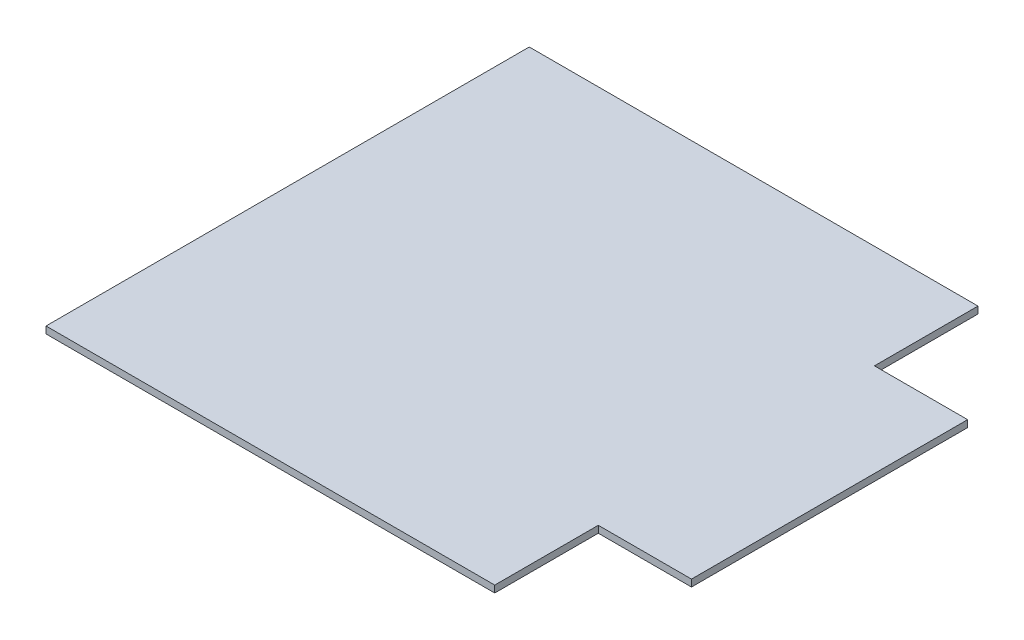
from build123d import *

# Parameters (mm, degrees)
BOSS_EXTRUDE1_DEPTH = 2


with BuildPart() as part:
    # Sketch1 → Boss-Extrude1 (new body)
    with BuildSketch(Plane(origin=(0, 0, 0), x_dir=(1, 0, 0), z_dir=(0, 1, 0))):
        Polygon((2.79533546, 60.475696308), (2.79533546, -79.524303692), (132.79533546, -79.524303692), (132.79533546, -49.524303692), (159.79533546, -49.524303692), (159.79533546, 30.475696308), (132.79533546, 30.475696308), (132.79533546, 60.475696308), align=None)
    extrude(amount=BOSS_EXTRUDE1_DEPTH)


solid = part.part
